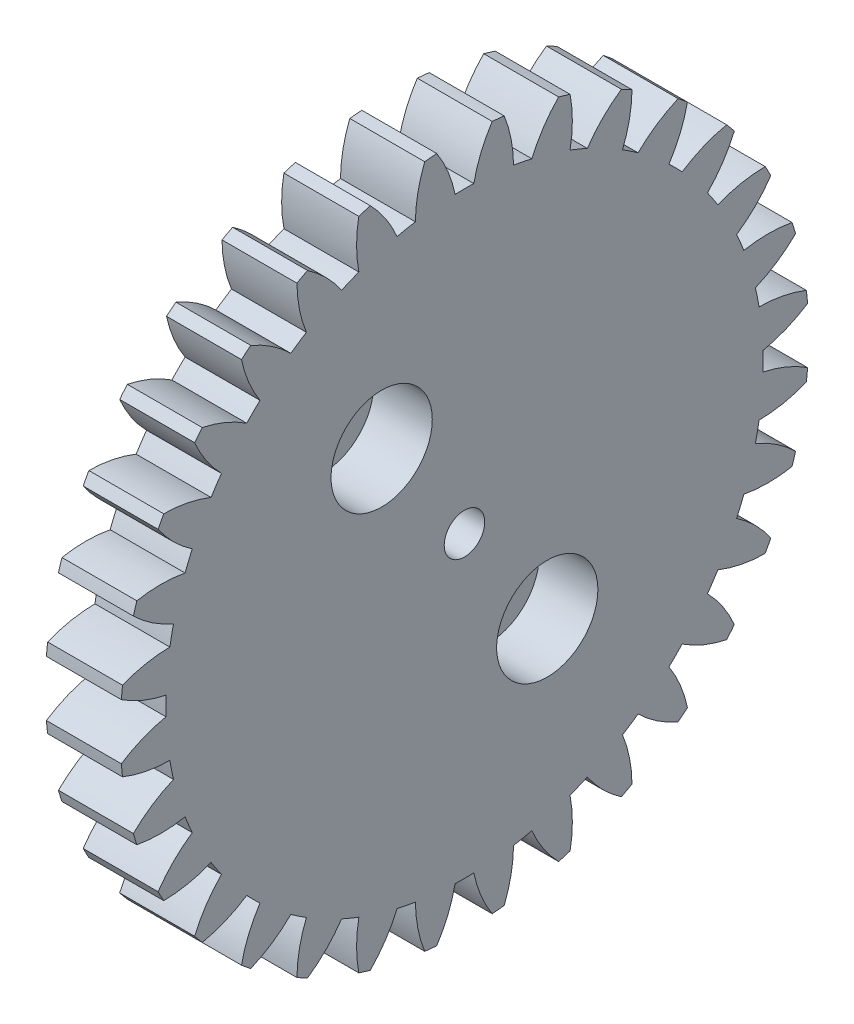
from build123d import *

# Parameters (mm, degrees)
BASPROSKE_W        = 3.7
BASPROSKE_H        = 17
TOOTHCUT_DEPTH     = 25.324678826
TEETHCUTS_COUNT    = 32
TEETHCUTS_ANGLE    = 348.75
BORSKE_R           = 1
BORE_DEPTH         = 50.0184912
SKETCH1_R          = 1.4
CUT_EXTRUDE1_DEPTH = 9
SKETCH3_R          = 2.5
CUT_EXTRUDE3_DEPTH = 2.9


with BuildPart() as part:
    # BasProSke → Base-Revolve (revolve)
    with BuildSketch(Plane(origin=(0, 0, 0), x_dir=(1, 0, 0), z_dir=(0, 1, 0))):
        with Locations((1.85, 8.5)):
            Rectangle(BASPROSKE_W, BASPROSKE_H)
    revolve(axis=Axis((-10, 0, 0), (1, 0, 0)))

    # TooCutSke → ToothCut (cut, through all)
    with BuildSketch(Plane(origin=(0, 0, 0), x_dir=(0, 0, -1), z_dir=(1, 0, 0))):
        with BuildLine():
            ThreePointArc((0.462036907, 14.741761187), (0, 14.749), (-0.462036907, 14.741761187))
            ThreePointArc((-0.462036907, 14.741761187), (-0.81854142, 15.899240468), (-1.386721275, 16.9688317))
            ThreePointArc((-1.386721275, 16.9688317), (0, 17.0254), (1.386721275, 16.9688317))
            ThreePointArc((1.386721275, 16.9688317), (0.81854142, 15.899240468), (0.462036907, 14.741761187))
        make_face()
    toothcut = extrude(amount=TOOTHCUT_DEPTH, mode=Mode.SUBTRACT)

    # TeethCuts: ToothCut ×32 about axis
    teethcuts_axis = Axis((-10, 0, 0), (1, 0, 0))
    for i in range(1, TEETHCUTS_COUNT):
        add(toothcut.rotate(teethcuts_axis, i * TEETHCUTS_ANGLE / (TEETHCUTS_COUNT - 1)), mode=Mode.SUBTRACT)

    # BorSke → Bore (cut, symmetric)
    with BuildSketch(Plane(origin=(0, 0, 0), x_dir=(0, 0, -1), z_dir=(1, 0, 0))):
        Circle(BORSKE_R)
    extrude(amount=BORE_DEPTH, both=True, mode=Mode.SUBTRACT)

    # Sketch1 → Cut-Extrude1 (cut)
    with BuildSketch(Plane(origin=(3.7, -93.630510751, 43.87052658), x_dir=(0, 0.453479715511308, -0.8912665973881122), z_dir=(1, 0, 0))):
        with Locations((82.628134559, 56.63734618)):
            Circle(SKETCH1_R)
        with Locations((80.491610098, 70.473359451)):
            Circle(SKETCH1_R)
    extrude(amount=-CUT_EXTRUDE1_DEPTH, mode=Mode.SUBTRACT)

    # Sketch3 → Cut-Extrude3 (cut)
    with BuildSketch(Plane(origin=(3.7, -93.630510751, 43.87052658), x_dir=(0, 0.453479715511308, -0.8912665973881122), z_dir=(1, 0, 0))):
        with Locations((82.628134559, 56.63734618)):
            Circle(SKETCH3_R)
        with Locations((80.491610098, 70.473359451)):
            Circle(SKETCH3_R)
    extrude(amount=-CUT_EXTRUDE3_DEPTH, mode=Mode.SUBTRACT)


solid = part.part
